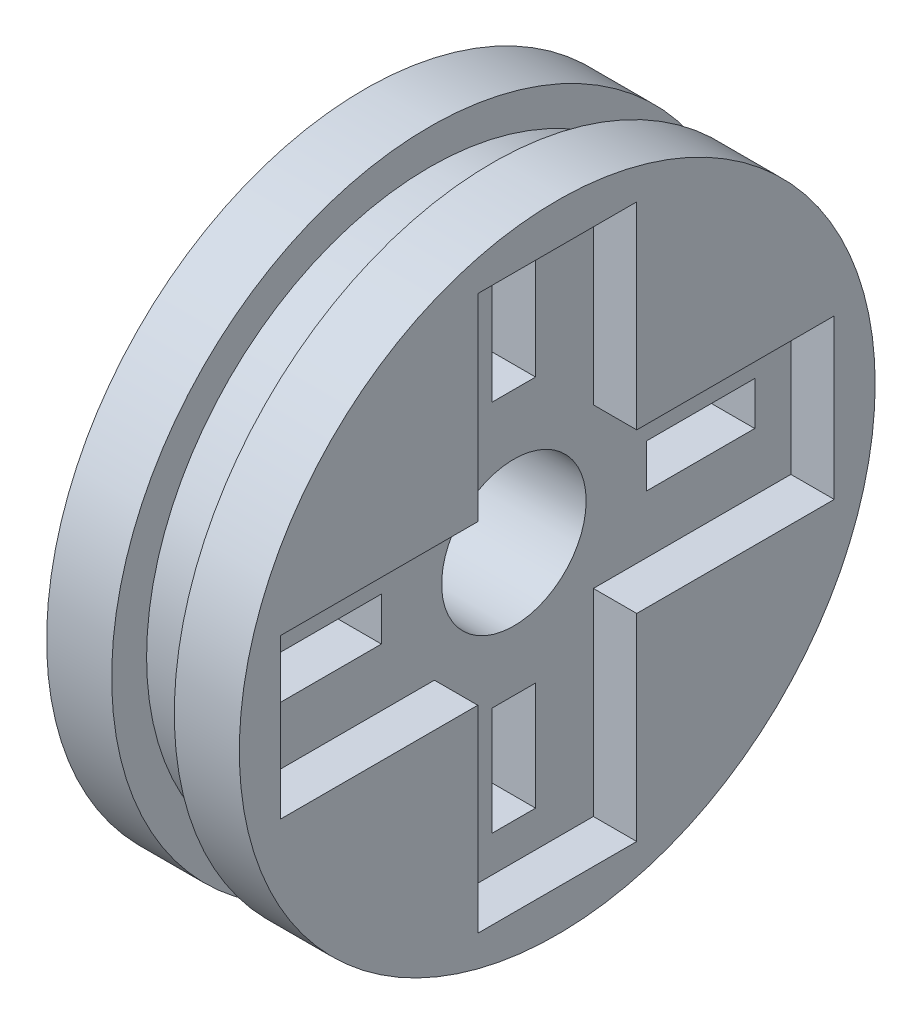
from build123d import *

# Parameters (mm, degrees)
BOSS_EXTRUDE1_START  = -85.2
SKETCH1_R            = 13.2
BOSS_EXTRUDE1_DEPTH  = 8
BOSS_EXTRUDE2_START  = -82.5
SKETCH2_R            = 20
BOSS_EXTRUDE2_DEPTH  = 2.6
BOSS_EXTRUDE3_START  = -82.5
SKETCH3_R            = 11.75
BOSS_EXTRUDE3_DEPTH  = 2.6
BOSS_EXTRUDE4_START  = -79
SKETCH4_R            = 4.6
BOSS_EXTRUDE4_DEPTH  = 2.3
BOSS_EXTRUDE5_START  = -55.3
SKETCH5_W            = 2.3
SKETCH5_H            = 11.5
BOSS_EXTRUDE5_DEPTH  = 6.6
BOSS_EXTRUDE6_START  = -52.9
SKETCH6_W            = 10
SKETCH6_H            = 4.5
BOSS_EXTRUDE6_DEPTH  = 1.8
BOSS_EXTRUDE7_START  = -55.3
SKETCH7_W            = 2.3
SKETCH7_H            = 11.5
BOSS_EXTRUDE7_DEPTH  = 6.6
BOSS_EXTRUDE8_START  = -52.9
SKETCH8_W            = 10
SKETCH8_H            = 4.5
BOSS_EXTRUDE8_DEPTH  = 1.8
BOSS_EXTRUDE9_START  = -52
SKETCH9_W            = 2.3
SKETCH9_H            = 6.6
BOSS_EXTRUDE9_DEPTH  = 11.5
BOSS_EXTRUDE10_START = -46.5
SKETCH10_W           = 10
SKETCH10_H           = 1.8
BOSS_EXTRUDE10_DEPTH = 4.5
BOSS_EXTRUDE11_START = -63.5
SKETCH11_W           = 2.3
SKETCH11_H           = 6.6
BOSS_EXTRUDE11_DEPTH = 11.5
BOSS_EXTRUDE12_START = -62
SKETCH12_W           = 10
SKETCH12_H           = 1.8
BOSS_EXTRUDE12_DEPTH = 4.5
BOSS_EXTRUDE13_START = -86.2
SKETCH13_R           = 3
BOSS_EXTRUDE13_DEPTH = 10


with BuildPart() as part:
    # Sketch1 → Boss-Extrude1 (new body)
    with BuildSketch(Plane(origin=(0, 0, 0), x_dir=(0, 0, -1), z_dir=(1, 0, 0)).offset(BOSS_EXTRUDE1_START)):
        with Locations((52, -65)):
            Circle(SKETCH1_R)
    extrude(amount=BOSS_EXTRUDE1_DEPTH)


with BuildPart() as body_2:
    # Sketch2 → Boss-Extrude2 (new body)
    with BuildSketch(Plane(origin=(0, 0, 0), x_dir=(0, 0, -1), z_dir=(1, 0, 0)).offset(BOSS_EXTRUDE2_START)):
        with Locations((52, -65)):
            Circle(SKETCH2_R)
    extrude(amount=BOSS_EXTRUDE2_DEPTH)


with BuildPart() as part_1:
    add(part.part)

    # Combine1: cut body 2
    add(body_2.part, mode=Mode.SUBTRACT)

    # Sketch3 → Boss-Extrude3 (add)
    with BuildSketch(Plane(origin=(0, 0, 0), x_dir=(0, 0, -1), z_dir=(1, 0, 0)).offset(BOSS_EXTRUDE3_START)):
        with Locations((52, -65)):
            Circle(SKETCH3_R)
    extrude(amount=BOSS_EXTRUDE3_DEPTH)


with BuildPart() as body_2_2:
    # Sketch4 → Boss-Extrude4 (new body)
    with BuildSketch(Plane(origin=(0, 0, 0), x_dir=(0, 0, -1), z_dir=(1, 0, 0)).offset(BOSS_EXTRUDE4_START)):
        with Locations((52, -65)):
            Circle(SKETCH4_R)
    extrude(amount=BOSS_EXTRUDE4_DEPTH)


with BuildPart() as part_2:
    add(part_1.part)

    # Combine2: cut body 2 2
    add(body_2_2.part, mode=Mode.SUBTRACT)


with BuildPart() as body_2_3:
    # Sketch5 → Boss-Extrude5 (new body)
    with BuildSketch(Plane.XY.offset(BOSS_EXTRUDE5_START)):
        with Locations((-77.85, -59.25)):
            Rectangle(SKETCH5_W, SKETCH5_H)
    extrude(amount=BOSS_EXTRUDE5_DEPTH)


with BuildPart() as part_3:
    add(part_2.part)

    # Combine3: cut body 2 3
    add(body_2_3.part, mode=Mode.SUBTRACT)


with BuildPart() as body_2_4:
    # Sketch6 → Boss-Extrude6 (new body)
    with BuildSketch(Plane.XY.offset(BOSS_EXTRUDE6_START)):
        with Locations((-81.2, -57.25)):
            Rectangle(SKETCH6_W, SKETCH6_H)
    extrude(amount=BOSS_EXTRUDE6_DEPTH)


with BuildPart() as part_4:
    add(part_3.part)

    # Combine4: cut body 2 4
    add(body_2_4.part, mode=Mode.SUBTRACT)


with BuildPart() as body_2_5:
    # Sketch7 → Boss-Extrude7 (new body)
    with BuildSketch(Plane.XY.offset(BOSS_EXTRUDE7_START)):
        with Locations((-77.85, -70.75)):
            Rectangle(SKETCH7_W, SKETCH7_H)
    extrude(amount=BOSS_EXTRUDE7_DEPTH)


with BuildPart() as part_5:
    add(part_4.part)

    # Combine5: cut body 2 5
    add(body_2_5.part, mode=Mode.SUBTRACT)


with BuildPart() as body_2_6:
    # Sketch8 → Boss-Extrude8 (new body)
    with BuildSketch(Plane.XY.offset(BOSS_EXTRUDE8_START)):
        with Locations((-81.2, -72.75)):
            Rectangle(SKETCH8_W, SKETCH8_H)
    extrude(amount=BOSS_EXTRUDE8_DEPTH)


with BuildPart() as part_6:
    add(part_5.part)

    # Combine6: cut body 2 6
    add(body_2_6.part, mode=Mode.SUBTRACT)


with BuildPart() as body_2_7:
    # Sketch9 → Boss-Extrude9 (new body)
    with BuildSketch(Plane.XY.offset(BOSS_EXTRUDE9_START)):
        with Locations((-77.85, -65)):
            Rectangle(SKETCH9_W, SKETCH9_H)
    extrude(amount=BOSS_EXTRUDE9_DEPTH)


with BuildPart() as part_7:
    add(part_6.part)

    # Combine7: cut body 2 7
    add(body_2_7.part, mode=Mode.SUBTRACT)


with BuildPart() as body_2_8:
    # Sketch10 → Boss-Extrude10 (new body)
    with BuildSketch(Plane.XY.offset(BOSS_EXTRUDE10_START)):
        with Locations((-81.2, -65)):
            Rectangle(SKETCH10_W, SKETCH10_H)
    extrude(amount=BOSS_EXTRUDE10_DEPTH)


with BuildPart() as part_8:
    add(part_7.part)

    # Combine8: cut body 2 8
    add(body_2_8.part, mode=Mode.SUBTRACT)


with BuildPart() as body_2_9:
    # Sketch11 → Boss-Extrude11 (new body)
    with BuildSketch(Plane.XY.offset(BOSS_EXTRUDE11_START)):
        with Locations((-77.85, -65)):
            Rectangle(SKETCH11_W, SKETCH11_H)
    extrude(amount=BOSS_EXTRUDE11_DEPTH)


with BuildPart() as part_9:
    add(part_8.part)

    # Combine9: cut body 2 9
    add(body_2_9.part, mode=Mode.SUBTRACT)


with BuildPart() as body_2_10:
    # Sketch12 → Boss-Extrude12 (new body)
    with BuildSketch(Plane.XY.offset(BOSS_EXTRUDE12_START)):
        with Locations((-81.2, -65)):
            Rectangle(SKETCH12_W, SKETCH12_H)
    extrude(amount=BOSS_EXTRUDE12_DEPTH)


with BuildPart() as part_10:
    add(part_9.part)

    # Combine10: cut body 2 10
    add(body_2_10.part, mode=Mode.SUBTRACT)


with BuildPart() as body_2_11:
    # Sketch13 → Boss-Extrude13 (new body)
    with BuildSketch(Plane(origin=(0, 0, 0), x_dir=(0, 0, -1), z_dir=(1, 0, 0)).offset(BOSS_EXTRUDE13_START)):
        with Locations((52, -65)):
            Circle(SKETCH13_R)
    extrude(amount=BOSS_EXTRUDE13_DEPTH)


with BuildPart() as part_11:
    add(part_10.part)

    # Combine11: cut body 2 11
    add(body_2_11.part, mode=Mode.SUBTRACT)


solid = part_11.part
